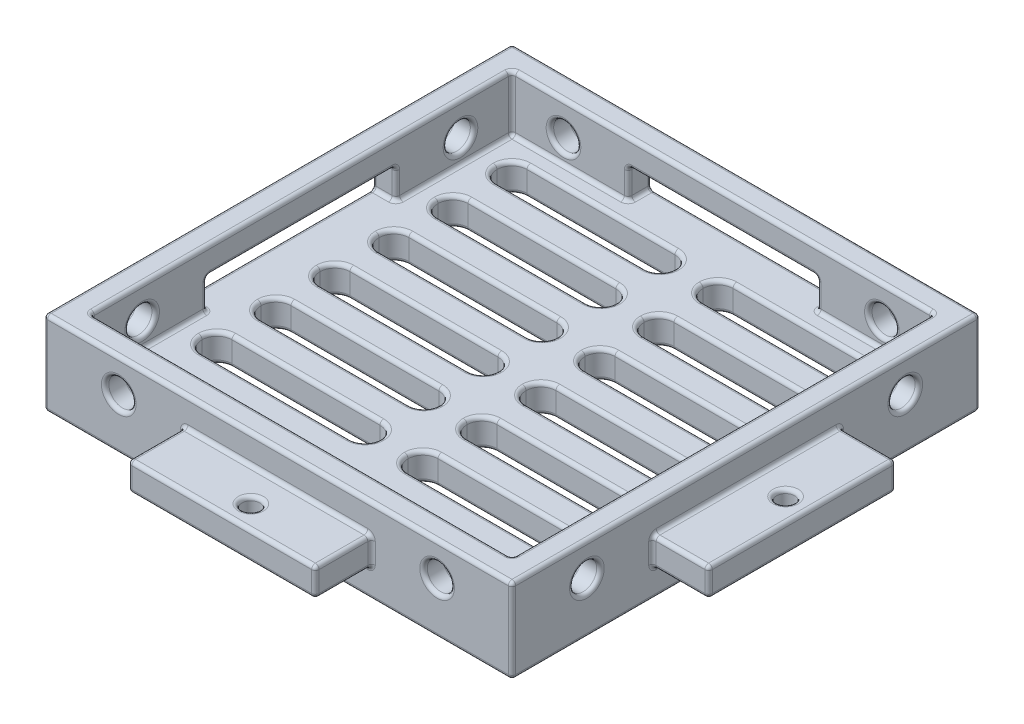
from build123d import *

# Parameters (mm, degrees)
SKETCH1_W           = 50
SKETCH1_H           = 50
BOSS_EXTRUDE1_DEPTH = 3
SKETCH2_W           = 50
SKETCH2_H           = 50
SKETCH2_W_2         = 45
SKETCH2_H_2         = 45
BOSS_EXTRUDE2_DEPTH = 6
SKETCH3_W           = 20.2
SKETCH3_H           = 3.2
CUT_EXTRUDE1_DEPTH  = 5
SKETCH4_W           = 20
SKETCH4_H           = 3
BOSS_EXTRUDE3_DEPTH = 6
SKETCH5_R           = 1.45
CUT_EXTRUDE2_DEPTH  = 76.610845783
SKETCH9_R           = 0.95
CUT_EXTRUDE3_DEPTH  = 76.312681535
CIRPATTERN1_COUNT   = 2
CIRPATTERN1_ANGLE   = 90
SKETCH10_W          = 19
SKETCH10_H          = 3.2
CUT_EXTRUDE4_DEPTH  = 80.422918607
FILLET1_R           = 1.6
FILLET2_R           = 0.4


with BuildPart() as part:
    # Sketch1 → Boss-Extrude1 (new body)
    with BuildSketch(Plane(origin=(0, 0, 0), x_dir=(1, 0, 0), z_dir=(0, 1, 0))):
        with Locations((25, -25)):
            Rectangle(SKETCH1_W, SKETCH1_H)
    extrude(amount=BOSS_EXTRUDE1_DEPTH)

    # Sketch2 → Boss-Extrude2 (add)
    with BuildSketch(Plane(origin=(0, 3, 0), x_dir=(1, 0, 0), z_dir=(0, 1, 0))):
        with Locations((25, -25)):
            Rectangle(SKETCH2_W, SKETCH2_H)
        with Locations((25, -25)):
            Rectangle(SKETCH2_W_2, SKETCH2_H_2, mode=Mode.SUBTRACT)
    extrude(amount=BOSS_EXTRUDE2_DEPTH)

    # Sketch3 → Cut-Extrude1 (cut)
    with BuildSketch(Plane(origin=(2.5, 0, 0), x_dir=(0, 0, -1), z_dir=(1, 0, 0))):
        with Locations((-25, 4.6)):
            Rectangle(SKETCH3_W, SKETCH3_H)
    cut_extrude1 = extrude(amount=-CUT_EXTRUDE1_DEPTH, mode=Mode.SUBTRACT)

    # Sketch4 → Boss-Extrude3 (add)
    with BuildSketch(Plane(origin=(50, 0, 0), x_dir=(0, 0, -1), z_dir=(1, 0, 0))):
        with Locations((-25, 4.5)):
            Rectangle(SKETCH4_W, SKETCH4_H)
    boss_extrude3 = extrude(amount=BOSS_EXTRUDE3_DEPTH)

    # Sketch5 → Cut-Extrude2 (cut, through all)
    with BuildSketch(Plane.ZY):
        with Locations((8, 5.5)):
            Circle(SKETCH5_R)
        with Locations((42, 5.5)):
            Circle(SKETCH5_R)
    cut_extrude2 = extrude(amount=-CUT_EXTRUDE2_DEPTH, mode=Mode.SUBTRACT)

    # Sketch9 → Cut-Extrude3 (cut, through all)
    with BuildSketch(Plane(origin=(0, 6, 0), x_dir=(1, 0, 0), z_dir=(0, 1, 0))):
        with Locations(Location((53.55, -24.33362413, 0), (0, 0, 270))):
            Circle(SKETCH9_R)
    cut_extrude3 = extrude(amount=-CUT_EXTRUDE3_DEPTH, mode=Mode.SUBTRACT)

    # CirPattern1: Cut-Extrude1, Boss-Extrude3, Cut-Extrude2, Cut-Extrude3 ×2 about axis
    cirpattern1_axis = Axis((25, 0, 25), (0, -1, 0))
    add([cut_extrude1.rotate(cirpattern1_axis, i * CIRPATTERN1_ANGLE / (CIRPATTERN1_COUNT - 1)) for i in range(1, CIRPATTERN1_COUNT)], mode=Mode.SUBTRACT)
    add([boss_extrude3.rotate(cirpattern1_axis, i * CIRPATTERN1_ANGLE / (CIRPATTERN1_COUNT - 1)) for i in range(1, CIRPATTERN1_COUNT)])
    add([cut_extrude2.rotate(cirpattern1_axis, i * CIRPATTERN1_ANGLE / (CIRPATTERN1_COUNT - 1)) for i in range(1, CIRPATTERN1_COUNT)], mode=Mode.SUBTRACT)
    add([cut_extrude3.rotate(cirpattern1_axis, i * CIRPATTERN1_ANGLE / (CIRPATTERN1_COUNT - 1)) for i in range(1, CIRPATTERN1_COUNT)], mode=Mode.SUBTRACT)

    # Sketch10 → Cut-Extrude4 (cut, through all)
    with BuildSketch(Plane(origin=(0, 3, 0), x_dir=(1, 0, 0), z_dir=(0, 1, 0))):
        with Locations((14, -6.1)):
            Rectangle(SKETCH10_W, SKETCH10_H)
        with Locations((36, -6.1)):
            Rectangle(SKETCH10_W, SKETCH10_H)
        with Locations((36, -12.4)):
            Rectangle(SKETCH10_W, SKETCH10_H)
        with Locations((36, -18.7)):
            Rectangle(SKETCH10_W, SKETCH10_H)
        with Locations((36, -25)):
            Rectangle(SKETCH10_W, SKETCH10_H)
        with Locations((36, -31.3)):
            Rectangle(SKETCH10_W, SKETCH10_H)
        with Locations((36, -37.6)):
            Rectangle(SKETCH10_W, SKETCH10_H)
        with Locations((36, -43.9)):
            Rectangle(SKETCH10_W, SKETCH10_H)
        with Locations((14, -12.4)):
            Rectangle(SKETCH10_W, SKETCH10_H)
        with Locations((14, -18.7)):
            Rectangle(SKETCH10_W, SKETCH10_H)
        with Locations((14, -25)):
            Rectangle(SKETCH10_W, SKETCH10_H)
        with Locations((14, -31.3)):
            Rectangle(SKETCH10_W, SKETCH10_H)
        with Locations((14, -37.6)):
            Rectangle(SKETCH10_W, SKETCH10_H)
        with Locations((14, -43.9)):
            Rectangle(SKETCH10_W, SKETCH10_H)
    extrude(amount=-CUT_EXTRUDE4_DEPTH, mode=Mode.SUBTRACT)

    # Fillet1
    fillet1_edges = [part.edges().sort_by_distance(p)[0] for p in [
        (23.5, 1.5, 7.7),
        (4.5, 1.5, 7.7),
        (23.5, 1.5, 45.5),
        (4.5, 1.5, 45.5),
        (4.5, 1.5, 42.3),
        (23.5, 1.5, 42.3),
        (23.5, 1.5, 39.2),
        (4.5, 1.5, 39.2),
        (4.5, 1.5, 36),
        (23.5, 1.5, 36),
        (23.5, 1.5, 32.9),
        (4.5, 1.5, 32.9),
        (4.5, 1.5, 29.7),
        (23.5, 1.5, 29.7),
        (23.5, 1.5, 26.6),
        (4.5, 1.5, 26.6),
        (4.5, 1.5, 23.4),
        (23.5, 1.5, 23.4),
        (23.5, 1.5, 20.3),
        (4.5, 1.5, 20.3),
        (4.5, 1.5, 17.1),
        (23.5, 1.5, 17.1),
        (45.5, 1.5, 7.7),
        (26.5, 1.5, 7.7),
        (26.5, 1.5, 4.5),
        (45.5, 1.5, 4.5),
        (45.5, 1.5, 14),
        (26.5, 1.5, 14),
        (26.5, 1.5, 10.8),
        (45.5, 1.5, 10.8),
        (45.5, 1.5, 20.3),
        (26.5, 1.5, 20.3),
        (26.5, 1.5, 17.1),
        (45.5, 1.5, 17.1),
        (45.5, 1.5, 26.6),
        (26.5, 1.5, 26.6),
        (26.5, 1.5, 23.4),
        (45.5, 1.5, 23.4),
        (23.5, 1.5, 14),
        (4.5, 1.5, 14),
        (4.5, 1.5, 10.8),
        (23.5, 1.5, 10.8),
        (45.5, 1.5, 45.5),
        (26.5, 1.5, 45.5),
        (26.5, 1.5, 42.3),
        (45.5, 1.5, 42.3),
        (45.5, 1.5, 39.2),
        (26.5, 1.5, 39.2),
        (26.5, 1.5, 36),
        (45.5, 1.5, 36),
        (45.5, 1.5, 32.9),
        (26.5, 1.5, 32.9),
        (26.5, 1.5, 29.7),
        (45.5, 1.5, 29.7),
        (23.5, 1.5, 4.5),
        (4.5, 1.5, 4.5),
    ]]
    fillet(fillet1_edges, radius=FILLET1_R - 0.0001)  # a hair under: the kernel refuses the full size

    # Fillet2
    fillet2_edges = [part.edges().sort_by_distance(p)[0] for p in [
        (14.9, 4.6, 2.5),
        (35.1, 4.6, 2.5),
        (25, 6.2, 2.5),
        (15, 4.5, 50),
        (15, 6, 53),
        (25, 3, 50),
        (15, 3, 53),
        (35, 4.5, 50),
        (35, 3, 53),
        (25, 6, 50),
        (35, 6, 53),
        (15, 4.5, 56),
        (25, 3, 56),
        (35, 4.5, 56),
        (25, 6, 56),
        (43.45, 5.5, 50),
        (43.45, 5.5, 47.5),
        (43.45, 5.5, 2.5),
        (43.45, 5.5, 0),
        (9.45, 5.5, 50),
        (9.45, 5.5, 47.5),
        (9.45, 5.5, 2.5),
        (9.45, 5.5, 0),
        (26.61637587, 3, 53.55),
        (26.61637587, 6, 53.55),
        (25, 9, 0),
        (0, 9, 25),
        (25, 9, 50),
        (50, 9, 25),
        (41.3, 3, 2.5),
        (2.5, 3, 8.7),
        (25, 3, 47.5),
        (47.5, 3, 25),
        (25, 9, 2.5),
        (2.5, 6, 2.5),
        (2.5, 9, 25),
        (2.5, 6, 47.5),
        (25, 9, 47.5),
        (47.5, 6, 47.5),
        (47.5, 9, 25),
        (47.5, 6, 2.5),
        (14, 3, 7.7),
        (14, 0, 7.7),
        (14, 3, 45.5),
        (14, 0, 45.5),
        (14, 3, 42.3),
        (14, 0, 42.3),
        (14, 3, 39.2),
        (14, 0, 39.2),
        (14, 3, 36),
        (14, 0, 36),
        (14, 3, 32.9),
        (14, 0, 32.9),
        (14, 3, 29.7),
        (14, 0, 29.7),
        (2.5, 3, 41.3),
        (14, 3, 26.6),
        (14, 0, 26.6),
        (14, 3, 23.4),
        (14, 0, 23.4),
        (14, 3, 20.3),
        (14, 0, 20.3),
        (14, 3, 17.1),
        (14, 0, 17.1),
        (36, 3, 7.7),
        (36, 0, 7.7),
        (36, 3, 4.5),
        (36, 0, 4.5),
        (36, 3, 14),
        (36, 0, 14),
        (36, 3, 10.8),
        (36, 0, 10.8),
        (36, 3, 20.3),
        (36, 0, 20.3),
        (36, 3, 17.1),
        (36, 0, 17.1),
        (36, 3, 26.6),
        (36, 0, 26.6),
        (36, 3, 23.4),
        (36, 0, 23.4),
        (14, 3, 14),
        (14, 0, 14),
        (14, 3, 10.8),
        (14, 0, 10.8),
        (0, 4.6, 35.1),
        (1.25, 3, 35.1),
        (36, 3, 45.5),
        (0, 6.2, 25),
        (36, 0, 45.5),
        (1.25, 6.2, 35.1),
        (0, 4.6, 14.9),
        (36, 3, 42.3),
        (36, 0, 42.3),
        (1.25, 6.2, 14.9),
        (0, 3, 25),
        (36, 3, 39.2),
        (1.25, 3, 14.9),
        (36, 0, 39.2),
        (36, 3, 36),
        (36, 0, 36),
        (36, 3, 32.9),
        (36, 0, 32.9),
        (36, 3, 29.7),
        (36, 0, 29.7),
        (14, 3, 4.5),
        (14, 0, 4.5),
        (23.031400139, 3, 7.231400139),
        (23.031400139, 0, 7.231400139),
        (4.968599861, 3, 7.231400139),
        (4.968599861, 0, 7.231400139),
        (23.031400139, 3, 45.031400139),
        (23.031400139, 0, 45.031400139),
        (4.968599861, 3, 45.031400139),
        (4.968599861, 0, 45.031400139),
        (4.968599861, 3, 42.768599861),
        (4.968599861, 0, 42.768599861),
        (23.031400139, 3, 42.768599861),
        (23.031400139, 0, 42.768599861),
        (23.031400139, 3, 38.731400139),
        (23.031400139, 0, 38.731400139),
        (4.968599861, 3, 38.731400139),
        (2.5, 4.6, 35.1),
        (4.968599861, 0, 38.731400139),
        (4.968599861, 3, 36.468599861),
        (4.968599861, 0, 36.468599861),
        (23.031400139, 3, 36.468599861),
        (23.031400139, 0, 36.468599861),
        (23.031400139, 3, 32.431400139),
        (23.031400139, 0, 32.431400139),
        (4.968599861, 3, 32.431400139),
        (4.968599861, 0, 32.431400139),
        (4.968599861, 3, 30.168599861),
        (4.968599861, 0, 30.168599861),
        (23.031400139, 3, 30.168599861),
        (23.031400139, 0, 30.168599861),
        (2.5, 4.6, 14.9),
        (23.031400139, 3, 26.131400139),
        (23.031400139, 0, 26.131400139),
        (4.968599861, 3, 26.131400139),
        (4.968599861, 0, 26.131400139),
        (4.968599861, 3, 23.868599861),
        (4.968599861, 0, 23.868599861),
        (23.031400139, 3, 23.868599861),
        (2.5, 6.2, 25),
        (23.031400139, 0, 23.868599861),
        (23.031400139, 3, 19.831400139),
        (23.031400139, 0, 19.831400139),
        (4.968599861, 3, 19.831400139),
        (4.968599861, 0, 19.831400139),
        (4.968599861, 3, 17.568599861),
        (4.968599861, 0, 17.568599861),
        (23.031400139, 3, 17.568599861),
        (23.031400139, 0, 17.568599861),
        (45.031400139, 3, 7.231400139),
        (45.031400139, 0, 7.231400139),
        (26.968599861, 3, 7.231400139),
        (26.968599861, 0, 7.231400139),
        (26.968599861, 3, 4.968599861),
        (26.968599861, 0, 4.968599861),
        (45.031400139, 3, 4.968599861),
        (45.031400139, 0, 4.968599861),
        (45.031400139, 3, 13.531400139),
        (45.031400139, 0, 13.531400139),
        (26.968599861, 3, 13.531400139),
        (26.968599861, 0, 13.531400139),
        (26.968599861, 3, 11.268599861),
        (26.968599861, 0, 11.268599861),
        (45.031400139, 3, 11.268599861),
        (45.031400139, 0, 11.268599861),
        (45.031400139, 3, 19.831400139),
        (45.031400139, 0, 19.831400139),
        (26.968599861, 3, 19.831400139),
        (26.968599861, 0, 19.831400139),
        (26.968599861, 3, 17.568599861),
        (26.968599861, 0, 17.568599861),
        (45.031400139, 3, 17.568599861),
        (45.031400139, 0, 17.568599861),
        (45.031400139, 3, 26.131400139),
        (45.031400139, 0, 26.131400139),
        (26.968599861, 3, 26.131400139),
        (26.968599861, 0, 26.131400139),
        (26.968599861, 3, 23.868599861),
        (26.968599861, 0, 23.868599861),
        (45.031400139, 3, 23.868599861),
        (45.031400139, 0, 23.868599861),
        (23.031400139, 3, 13.531400139),
        (23.031400139, 0, 13.531400139),
        (4.968599861, 3, 13.531400139),
        (4.968599861, 0, 13.531400139),
        (4.968599861, 3, 11.268599861),
        (4.968599861, 0, 11.268599861),
        (23.031400139, 3, 11.268599861),
        (23.031400139, 0, 11.268599861),
        (45.031400139, 3, 45.031400139),
        (45.031400139, 0, 45.031400139),
        (26.968599861, 3, 45.031400139),
        (26.968599861, 0, 45.031400139),
        (26.968599861, 3, 42.768599861),
        (26.968599861, 0, 42.768599861),
        (45.031400139, 3, 42.768599861),
        (45.031400139, 0, 42.768599861),
        (45.031400139, 3, 38.731400139),
        (45.031400139, 0, 38.731400139),
        (26.968599861, 3, 38.731400139),
        (26.968599861, 0, 38.731400139),
        (26.968599861, 3, 36.468599861),
        (26.968599861, 0, 36.468599861),
        (45.031400139, 3, 36.468599861),
        (45.031400139, 0, 36.468599861),
        (45.031400139, 3, 32.431400139),
        (45.031400139, 0, 32.431400139),
        (26.968599861, 3, 32.431400139),
        (26.968599861, 0, 32.431400139),
        (26.968599861, 3, 30.168599861),
        (26.968599861, 0, 30.168599861),
        (45.031400139, 3, 30.168599861),
        (45.031400139, 0, 30.168599861),
        (23.031400139, 3, 4.968599861),
        (23.031400139, 0, 4.968599861),
        (4.968599861, 3, 4.968599861),
        (4.968599861, 0, 4.968599861),
        (25, 0, 0),
        (50, 0, 25),
        (25, 0, 50),
        (50, 4.5, 35),
        (53, 6, 35),
        (50, 3, 25),
        (53, 3, 35),
        (50, 4.5, 15),
        (0, 0, 25),
        (53, 3, 15),
        (50, 6, 25),
        (53, 6, 15),
        (56, 4.5, 35),
        (56, 3, 25),
        (56, 4.5, 15),
        (56, 6, 25),
        (50, 5.5, 6.55),
        (47.5, 5.5, 6.55),
        (2.5, 5.5, 6.55),
        (0, 5.5, 6.55),
        (0, 4.5, 0),
        (50, 4.5, 0),
        (50, 5.5, 40.55),
        (47.5, 5.5, 40.55),
        (2.5, 5.5, 40.55),
        (50, 4.5, 50),
        (0, 5.5, 40.55),
        (0, 4.5, 50),
        (53.55, 3, 23.38362413),
        (53.55, 6, 23.38362413),
        (8.7, 3, 2.5),
        (14.9, 4.6, 0),
        (14.9, 3, 1.25),
        (25, 6.2, 0),
        (14.9, 6.2, 1.25),
        (35.1, 4.6, 0),
        (35.1, 6.2, 1.25),
        (25, 3, 0),
        (35.1, 3, 1.25),
    ]]
    fillet(fillet2_edges, radius=FILLET2_R)


solid = part.part
